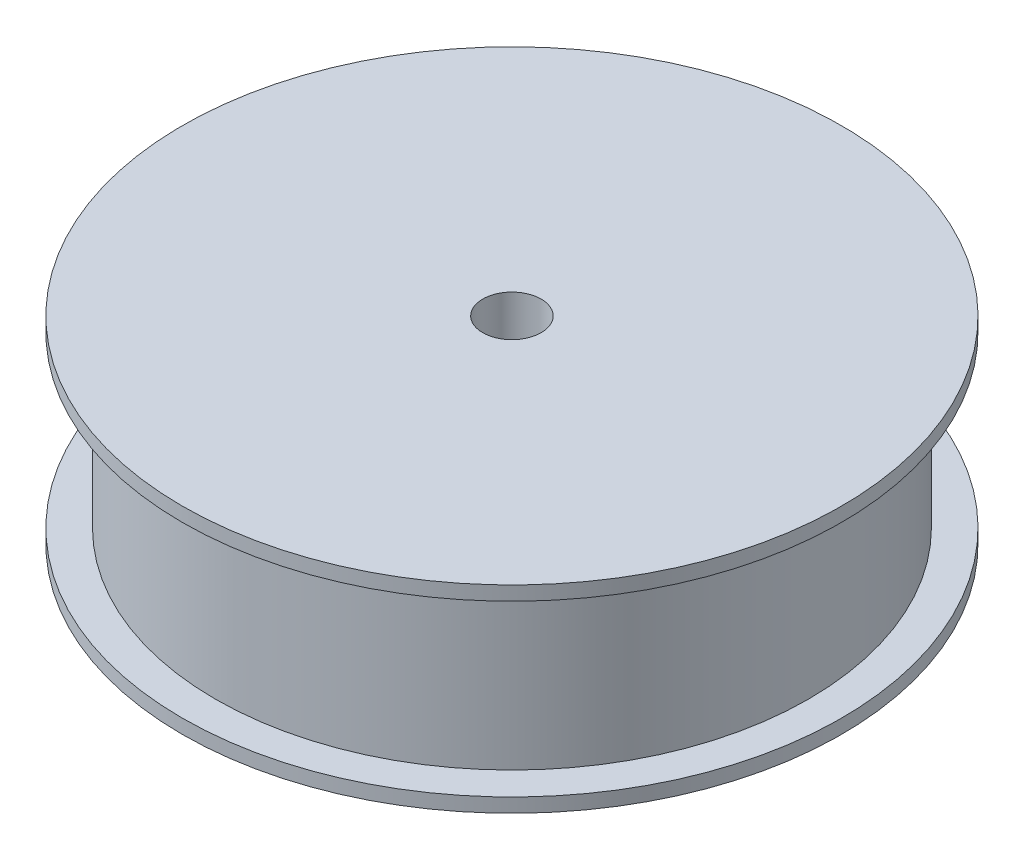
from build123d import *

# Parameters (mm, degrees)
SKETCH1_R           = 35
BOSS_EXTRUDE1_DEPTH = 1.5
SKETCH2_R           = 31.5
BOSS_EXTRUDE2_DEPTH = 18
SKETCH3_R           = 35
BOSS_EXTRUDE3_DEPTH = 1.5
SKETCH4_R           = 3.1
CUT_EXTRUDE1_DEPTH  = 54.768020235


with BuildPart() as part:
    # Sketch1 → Boss-Extrude1 (new body)
    with BuildSketch(Plane(origin=(0, 0, 0), x_dir=(1, 0, 0), z_dir=(0, 1, 0))):
        Circle(SKETCH1_R)
    extrude(amount=BOSS_EXTRUDE1_DEPTH)

    # Sketch2 → Boss-Extrude2 (add)
    with BuildSketch(Plane(origin=(0, 1.5, 0), x_dir=(1, 0, 0), z_dir=(0, 1, 0))):
        Circle(SKETCH2_R)
    extrude(amount=BOSS_EXTRUDE2_DEPTH)

    # Sketch3 → Boss-Extrude3 (add)
    with BuildSketch(Plane(origin=(0, 19.5, 0), x_dir=(1, 0, 0), z_dir=(0, 1, 0))):
        Circle(SKETCH3_R)
    extrude(amount=BOSS_EXTRUDE3_DEPTH)

    # Sketch4 → Cut-Extrude1 (cut, through all)
    with BuildSketch(Plane(origin=(0, 21, 0), x_dir=(1, 0, 0), z_dir=(0, 1, 0))):
        Circle(SKETCH4_R)
    extrude(amount=-CUT_EXTRUDE1_DEPTH, mode=Mode.SUBTRACT)


solid = part.part
